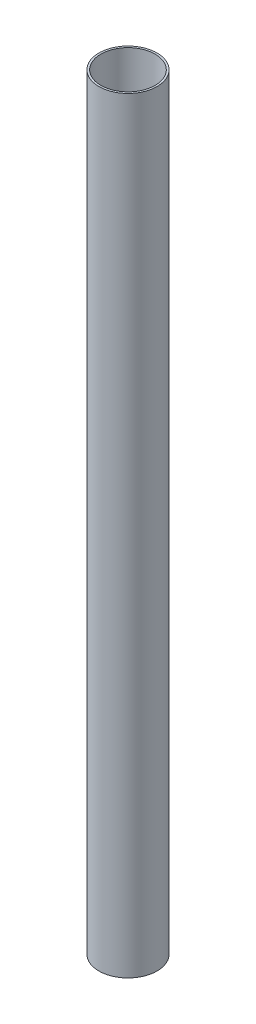
from build123d import *

# Parameters (mm, degrees)
SKETCH1_W = 1.9304
SKETCH1_H = 762


with BuildPart() as part:
    # Sketch1 → Revolve1 (revolve)
    with BuildSketch(Plane.XY):
        with Locations((27.9527, -330.014041553)):
            Rectangle(SKETCH1_W, SKETCH1_H)
    revolve(axis=Axis((0, 0, 0), (0, -1, 0)))


solid = part.part
